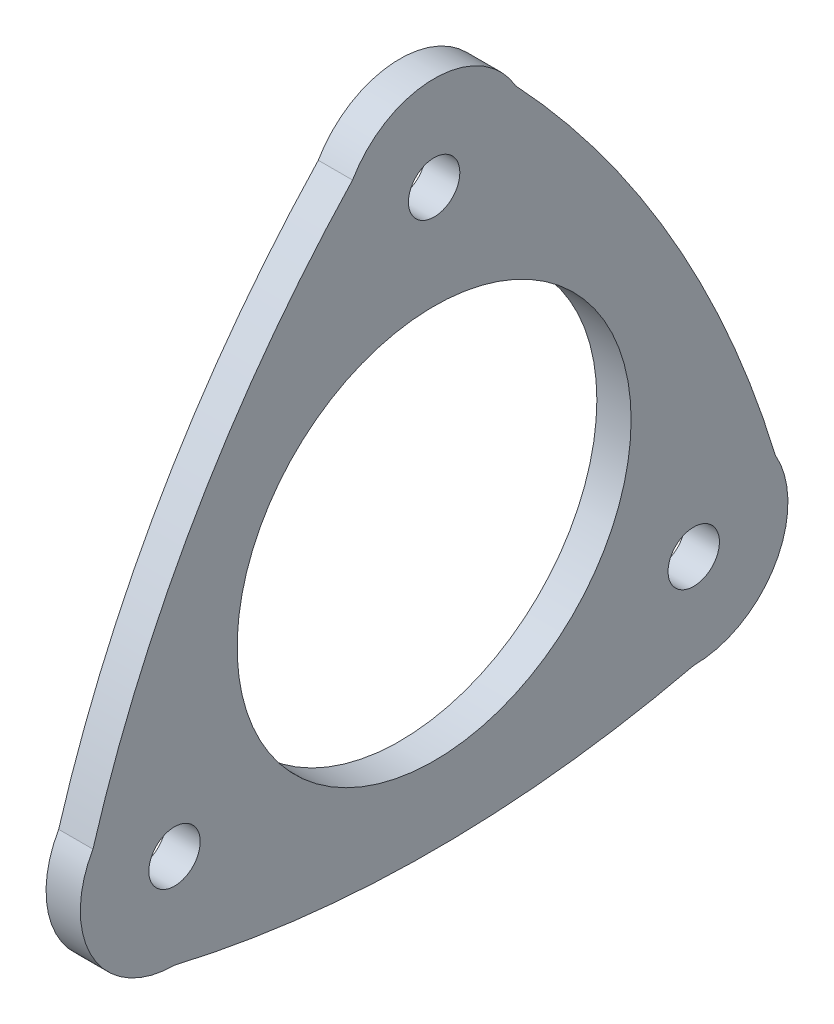
from build123d import *

# Parameters (mm, degrees)
SZKIC1_R                    = 3
SZKIC1_R_2                  = 23
DODANIE_WYCI_GNI_CIE1_DEPTH = 4


with BuildPart() as part:
    # Szkic1 → Dodanie-wyciągnięcie1 (new body)
    with BuildSketch(Plane(origin=(0, 0, 0), x_dir=(0, 0, -1), z_dir=(1, 0, 0))):
        with BuildLine():
            ThreePointArc((9.526279442, 40.5), (0, 46), (-9.526279442, 40.5))
            ThreePointArc((-9.526279442, 40.5), (-27.723127042, 16.00595486), (-39.837168574, -12))
            ThreePointArc((-39.837168574, -12), (-39.837168574, -23), (-30.310889132, -28.5))
            ThreePointArc((-30.310889132, -28.5), (0, -32.011909721), (30.310889132, -28.5))
            ThreePointArc((30.310889132, -28.5), (39.837168574, -23), (39.837168574, -12))
            ThreePointArc((39.837168574, -12), (27.723127042, 16.00595486), (9.526279442, 40.5))
        make_face()
        with Locations((30.310889132, -17.5)):
            Circle(SZKIC1_R, mode=Mode.SUBTRACT)
        with Locations((-30.310889132, -17.5)):
            Circle(SZKIC1_R, mode=Mode.SUBTRACT)
        Circle(SZKIC1_R_2, mode=Mode.SUBTRACT)
        with Locations((0, 35)):
            Circle(SZKIC1_R, mode=Mode.SUBTRACT)
    extrude(amount=DODANIE_WYCI_GNI_CIE1_DEPTH)


solid = part.part
